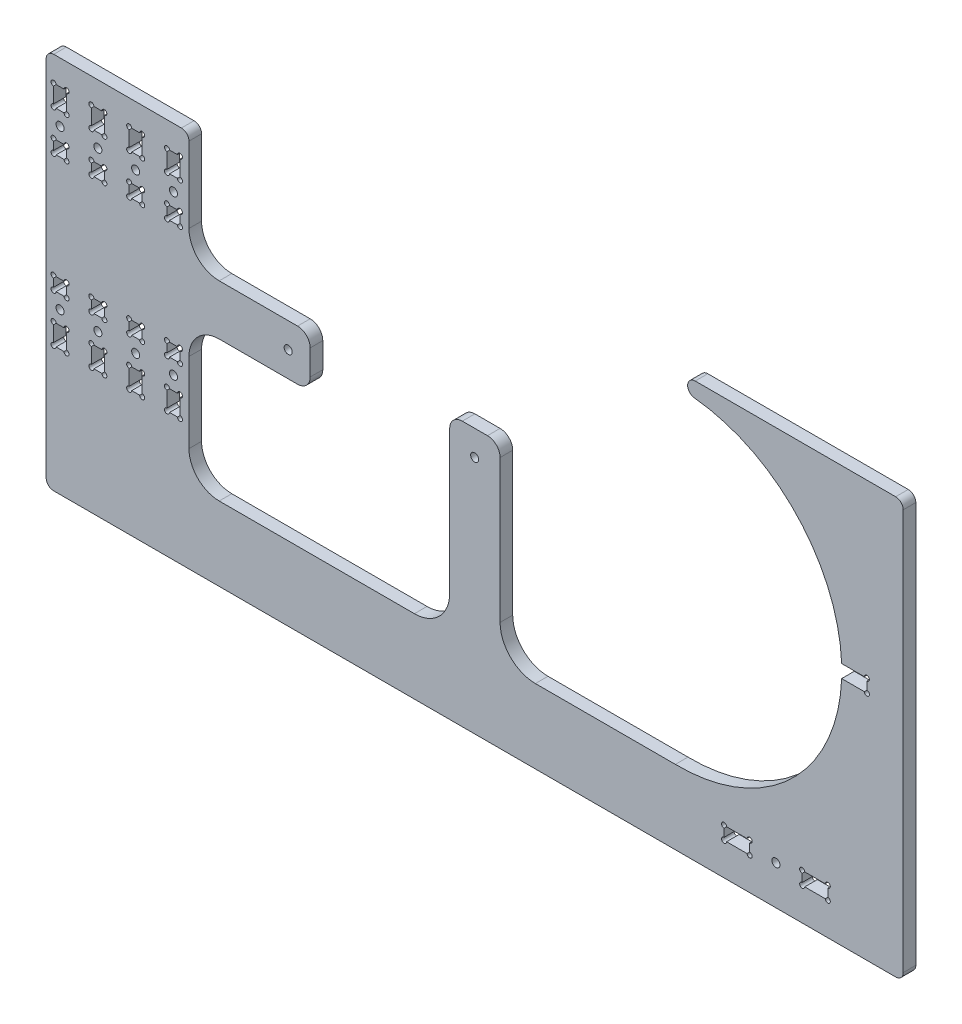
from build123d import *

# Parameters (mm, degrees)
ESBO_O1_R             = 1.500000231
ESBO_O1_R_2           = 1.500000287
ESBO_O1_R_3           = 1.500000265
ESBO_O1_W             = 5.150000881
ESBO_O1_H             = 5.150000897
ESBO_O1_H_2           = 5.150000136
ESBO_O1_H_3           = 8.1500015
ESBO_O1_H_4           = 8.150001441
ESBO_O1_W_2           = 10.150001764
ESBO_O1_H_5           = 5.150000882
ESBO_O1_W_3           = 10.150001763
FLANGE_BASE1_DEPTH    = 5
QUEBRA_CANTO1_START   = -5
QUEBRA_CANTO1_DEPTH   = 5
ESBO_O3_R             = 1
CORTE_EXTRUS_O1_DEPTH = 5
CORTE_EXTRUS_O2_REACH = 379.955
ESBO_O4_R             = 1.6


# Read off the part's stored shape, not the designer's step: Quebra-Canto1
# Sheet-metal steps are written as plain solids
with BuildPart() as part:
    # Esboço1 → Flange-base1 (new body)
    with BuildSketch(Plane.XY):
        with BuildLine():
            Line((-340, 3.000000529), (-340, 147.005540143))
            ThreePointArc((-340, 147.005540143), (-339.121320189, 149.126860861), (-336.999999471, 150.005540672))
            Line((-336.999999471, 150.005540672), (-286.361235163, 150.005540672))
            ThreePointArc((-286.361235163, 150.005540672), (-284.239914446, 149.126860861), (-283.361234634, 147.005540143))
            Line((-283.361234634, 147.005540143), (-283.361234634, 105.00038556))
            Line((-283.361234634, 105.00038556), (-240.264936372, 105.00038556))
            ThreePointArc((-240.264936372, 105.00038556), (-236.729401842, 103.535919208), (-235.26493549, 100.000384678))
            Line((-235.26493549, 100.000384678), (-235.26493549, 90.00001714))
            ThreePointArc((-235.26493549, 90.00001714), (-236.729401842, 86.46448261), (-240.264936372, 85.000016258))
            Line((-240.264936372, 85.000016258), (-283.361234635, 85.000016258))
            Line((-283.361234635, 85.000016258), (-283.361234635, 41.352845177))
            ThreePointArc((-283.361234635, 41.352845177), (-279.846515389, 32.867562306), (-271.361232518, 29.35284306))
            Line((-271.361232518, 29.35284306), (-193.918634842, 29.35284306))
            ThreePointArc((-193.918634842, 29.35284306), (-184.019138159, 33.453348847), (-179.918632372, 43.35284553))
            Line((-179.918632372, 43.35284553), (-179.918632372, 100.015701137))
            ThreePointArc((-179.918632372, 100.015701137), (-178.45416602, 103.551235666), (-174.91863149, 105.015702019))
            Line((-174.91863149, 105.015702019), (-164.925235472, 105.015702019))
            ThreePointArc((-164.925235472, 105.015702019), (-161.389700943, 103.551235666), (-159.92523459, 100.015701137))
            Line((-159.92523459, 100.015701137), (-159.92523459, 43.35284553))
            ThreePointArc((-159.92523459, 43.35284553), (-155.824728804, 33.453348847), (-145.925232121, 29.35284306))
            Line((-145.925232121, 29.35284306), (-90.389869404, 29.35284306))
            ThreePointArc((-90.389869404, 29.35284306), (-44.67362864, 47.143845796), (-24.411355946, 91.819731385))
            Line((-24.411355946, 91.819731385), (-14.410292398, 91.819731385))
            Line((-14.410292398, 91.819731385), (-14.410292398, 96.969732249))
            Line((-14.410292398, 96.969732249), (-24.415320599, 96.969732249))
            ThreePointArc((-24.415320599, 96.969732249), (-42.034855913, 138.899349917), (-82.825688056, 159.015236068))
            ThreePointArc((-82.825688056, 159.015236068), (-85.520194125, 162.151065128), (-82.523998015, 165.000029101))
            Line((-82.523998015, 165.000029101), (-3.000000529, 165.000029101))
            ThreePointArc((-3.000000529, 165.000029101), (-0.878679811, 164.12134929), (0, 162.000028572))
            Line((0, 162.000028572), (0, 3.000000529))
            ThreePointArc((0, 3.000000529), (-0.878679811, 0.878679811), (-3.000000529, 0))
            Line((-3.000000529, 0), (-336.999999471, 0))
            ThreePointArc((-336.999999471, 0), (-339.121320189, 0.878679811), (-340, 3.000000529))
        make_face()
        with Locations((-289.500044588, 63.50000978)):
            Circle(ESBO_O1_R, mode=Mode.SUBTRACT)
        with Locations((-289.500055373, 126.500024196)):
            Circle(ESBO_O1_R_2, mode=Mode.SUBTRACT)
        with Locations((-244.00004667, 95.000018171)):
            Circle(ESBO_O1_R_3, mode=Mode.SUBTRACT)
        with Locations((-170.000032516, 95.000018171)):
            Circle(ESBO_O1_R_3, mode=Mode.SUBTRACT)
        with Locations((-50.500009659, 15.500002965)):
            Circle(ESBO_O1_R_2, mode=Mode.SUBTRACT)
        with Locations((-304.500044588, 63.50000978)):
            Circle(ESBO_O1_R, mode=Mode.SUBTRACT)
        with Locations((-304.500055373, 126.500024196)):
            Circle(ESBO_O1_R_2, mode=Mode.SUBTRACT)
        with Locations((-319.500044588, 63.50000978)):
            Circle(ESBO_O1_R, mode=Mode.SUBTRACT)
        with Locations((-319.500055373, 126.500024196)):
            Circle(ESBO_O1_R_2, mode=Mode.SUBTRACT)
        with Locations((-334.500044588, 63.50000978)):
            Circle(ESBO_O1_R, mode=Mode.SUBTRACT)
        with Locations((-334.500055373, 126.500024196)):
            Circle(ESBO_O1_R_2, mode=Mode.SUBTRACT)
        with Locations((-289.499991094, 118.500022696)):
            Rectangle(ESBO_O1_W, ESBO_O1_H, mode=Mode.SUBTRACT)
        with Locations((-289.499991094, 71.500014026)):
            Rectangle(ESBO_O1_W, ESBO_O1_H_2, mode=Mode.SUBTRACT)
        with Locations((-289.499991094, 54.000010403)):
            Rectangle(ESBO_O1_W, ESBO_O1_H_3, mode=Mode.SUBTRACT)
        with Locations((-289.499991094, 136.000025968)):
            Rectangle(ESBO_O1_W, ESBO_O1_H_4, mode=Mode.SUBTRACT)
        with Locations((-35.004152945, 15.500002734)):
            Rectangle(ESBO_O1_W_2, ESBO_O1_H_5, mode=Mode.SUBTRACT)
        with Locations((-66.000012252, 15.500002734)):
            Rectangle(ESBO_O1_W_3, ESBO_O1_H_5, mode=Mode.SUBTRACT)
        with Locations((-304.499991094, 118.500022696)):
            Rectangle(ESBO_O1_W, ESBO_O1_H, mode=Mode.SUBTRACT)
        with Locations((-304.499991094, 71.500014026)):
            Rectangle(ESBO_O1_W, ESBO_O1_H_2, mode=Mode.SUBTRACT)
        with Locations((-304.499991094, 54.000010403)):
            Rectangle(ESBO_O1_W, ESBO_O1_H_3, mode=Mode.SUBTRACT)
        with Locations((-304.499991094, 136.000025968)):
            Rectangle(ESBO_O1_W, ESBO_O1_H_4, mode=Mode.SUBTRACT)
        with Locations((-319.499991094, 118.500022696)):
            Rectangle(ESBO_O1_W, ESBO_O1_H, mode=Mode.SUBTRACT)
        with Locations((-319.499991094, 71.500014026)):
            Rectangle(ESBO_O1_W, ESBO_O1_H_2, mode=Mode.SUBTRACT)
        with Locations((-319.499991094, 54.000010403)):
            Rectangle(ESBO_O1_W, ESBO_O1_H_3, mode=Mode.SUBTRACT)
        with Locations((-319.499991094, 136.000025968)):
            Rectangle(ESBO_O1_W, ESBO_O1_H_4, mode=Mode.SUBTRACT)
        with Locations((-334.499991094, 118.500022696)):
            Rectangle(ESBO_O1_W, ESBO_O1_H, mode=Mode.SUBTRACT)
        with Locations((-334.499991094, 71.500014026)):
            Rectangle(ESBO_O1_W, ESBO_O1_H_2, mode=Mode.SUBTRACT)
        with Locations((-334.499991094, 54.000010403)):
            Rectangle(ESBO_O1_W, ESBO_O1_H_3, mode=Mode.SUBTRACT)
        with Locations((-334.499991094, 136.000025968)):
            Rectangle(ESBO_O1_W, ESBO_O1_H_4, mode=Mode.SUBTRACT)
    extrude(amount=-FLANGE_BASE1_DEPTH)

    # Quebra-Canto1 outline → Quebra-Canto1 (add)
    with BuildSketch(Plane.XY.offset(QUEBRA_CANTO1_START)):
        with BuildLine():
            Line((-283.361234634, 105.00038556), (-271.361234634, 105.00038556))
            ThreePointArc((-271.361234634, 105.00038556), (-279.846516009, 108.515104186), (-283.361234634, 117.00038556))
            Line((-283.361234634, 117.00038556), (-283.361234634, 105.00038556))
        make_face()
        with BuildLine():
            Line((-283.361234635, 85.000016258), (-283.361234635, 73.000016258))
            ThreePointArc((-283.361234635, 73.000016258), (-279.846516009, 81.485297632), (-271.361234635, 85.000016258))
            Line((-271.361234635, 85.000016258), (-283.361234635, 85.000016258))
        make_face()
    extrude(amount=QUEBRA_CANTO1_DEPTH)

    # Esboço3 → Corte-extrusão1 (cut)
    with BuildSketch(Plane.XY):
        with Locations((-286.924990653, 140.075026689)):
            Circle(ESBO_O3_R)
        with Locations((-292.074991534, 140.075026689)):
            Circle(ESBO_O3_R)
        with Locations((-292.074991534, 131.925025248)):
            Circle(ESBO_O3_R)
        with Locations((-286.924990653, 131.925025248)):
            Circle(ESBO_O3_R)
        with Locations((-286.924990653, 74.075014094)):
            Circle(ESBO_O3_R)
        with Locations((-292.074991534, 74.075014094)):
            Circle(ESBO_O3_R)
        with Locations((-292.074991534, 68.925013958)):
            Circle(ESBO_O3_R)
        with Locations((-286.924990653, 68.925013958)):
            Circle(ESBO_O3_R)
        with Locations((-286.924990653, 58.075011153)):
            Circle(ESBO_O3_R)
        with Locations((-292.074991534, 58.075011153)):
            Circle(ESBO_O3_R)
        with Locations((-292.074991534, 49.925009653)):
            Circle(ESBO_O3_R)
        with Locations((-286.924990653, 49.925009653)):
            Circle(ESBO_O3_R)
        with Locations((-29.929152063, 12.925002293)):
            Circle(ESBO_O3_R)
        with Locations((-29.929152063, 18.075003175)):
            Circle(ESBO_O3_R)
        with Locations((-40.079153827, 18.075003175)):
            Circle(ESBO_O3_R)
        with Locations((-40.079153827, 12.925002293)):
            Circle(ESBO_O3_R)
        with Locations((-60.92501137, 12.925002293)):
            Circle(ESBO_O3_R)
        with Locations((-60.92501137, 18.075003175)):
            Circle(ESBO_O3_R)
        with Locations((-71.075013133, 18.075003175)):
            Circle(ESBO_O3_R)
        with Locations((-71.075013133, 12.925002293)):
            Circle(ESBO_O3_R)
        with Locations((-292.074991534, 121.075023144)):
            Circle(ESBO_O3_R)
        with Locations((-292.074991534, 115.925022247)):
            Circle(ESBO_O3_R)
        with Locations((-286.924990653, 115.925022247)):
            Circle(ESBO_O3_R)
        with Locations((-286.924990653, 121.075023144)):
            Circle(ESBO_O3_R)
        with Locations((-301.924990653, 140.075026689)):
            Circle(ESBO_O3_R)
        with Locations((-307.074991534, 140.075026689)):
            Circle(ESBO_O3_R)
        with Locations((-307.074991534, 131.925025248)):
            Circle(ESBO_O3_R)
        with Locations((-301.924990653, 131.925025248)):
            Circle(ESBO_O3_R)
        with Locations((-301.924990653, 74.075014094)):
            Circle(ESBO_O3_R)
        with Locations((-307.074991534, 74.075014094)):
            Circle(ESBO_O3_R)
        with Locations((-307.074991534, 68.925013958)):
            Circle(ESBO_O3_R)
        with Locations((-301.924990653, 68.925013958)):
            Circle(ESBO_O3_R)
        with Locations((-301.924990653, 58.075011153)):
            Circle(ESBO_O3_R)
        with Locations((-307.074991534, 58.075011153)):
            Circle(ESBO_O3_R)
        with Locations((-307.074991534, 49.925009653)):
            Circle(ESBO_O3_R)
        with Locations((-301.924990653, 49.925009653)):
            Circle(ESBO_O3_R)
        with Locations((-307.074991534, 121.075023144)):
            Circle(ESBO_O3_R)
        with Locations((-307.074991534, 115.925022247)):
            Circle(ESBO_O3_R)
        with Locations((-301.924990653, 115.925022247)):
            Circle(ESBO_O3_R)
        with Locations((-301.924990653, 121.075023144)):
            Circle(ESBO_O3_R)
        with Locations((-316.924990653, 140.075026689)):
            Circle(ESBO_O3_R)
        with Locations((-322.074991534, 140.075026689)):
            Circle(ESBO_O3_R)
        with Locations((-322.074991534, 131.925025248)):
            Circle(ESBO_O3_R)
        with Locations((-316.924990653, 131.925025248)):
            Circle(ESBO_O3_R)
        with Locations((-316.924990653, 74.075014094)):
            Circle(ESBO_O3_R)
        with Locations((-322.074991534, 74.075014094)):
            Circle(ESBO_O3_R)
        with Locations((-322.074991534, 68.925013958)):
            Circle(ESBO_O3_R)
        with Locations((-316.924990653, 68.925013958)):
            Circle(ESBO_O3_R)
        with Locations((-316.924990653, 58.075011153)):
            Circle(ESBO_O3_R)
        with Locations((-322.074991534, 58.075011153)):
            Circle(ESBO_O3_R)
        with Locations((-322.074991534, 49.925009653)):
            Circle(ESBO_O3_R)
        with Locations((-316.924990653, 49.925009653)):
            Circle(ESBO_O3_R)
        with Locations((-322.074991534, 121.075023144)):
            Circle(ESBO_O3_R)
        with Locations((-322.074991534, 115.925022247)):
            Circle(ESBO_O3_R)
        with Locations((-316.924990653, 115.925022247)):
            Circle(ESBO_O3_R)
        with Locations((-316.924990653, 121.075023144)):
            Circle(ESBO_O3_R)
        with Locations((-331.924990653, 140.075026689)):
            Circle(ESBO_O3_R)
        with Locations((-337.074991534, 140.075026689)):
            Circle(ESBO_O3_R)
        with Locations((-337.074991534, 131.925025248)):
            Circle(ESBO_O3_R)
        with Locations((-331.924990653, 131.925025248)):
            Circle(ESBO_O3_R)
        with Locations((-331.924990653, 74.075014094)):
            Circle(ESBO_O3_R)
        with Locations((-337.074991534, 74.075014094)):
            Circle(ESBO_O3_R)
        with Locations((-337.074991534, 68.925013958)):
            Circle(ESBO_O3_R)
        with Locations((-331.924990653, 68.925013958)):
            Circle(ESBO_O3_R)
        with Locations((-331.924990653, 58.075011153)):
            Circle(ESBO_O3_R)
        with Locations((-337.074991534, 58.075011153)):
            Circle(ESBO_O3_R)
        with Locations((-337.074991534, 49.925009653)):
            Circle(ESBO_O3_R)
        with Locations((-331.924990653, 49.925009653)):
            Circle(ESBO_O3_R)
        with Locations((-337.074991534, 121.075023144)):
            Circle(ESBO_O3_R)
        with Locations((-337.074991534, 115.925022247)):
            Circle(ESBO_O3_R)
        with Locations((-331.924990653, 115.925022247)):
            Circle(ESBO_O3_R)
        with Locations((-331.924990653, 121.075023144)):
            Circle(ESBO_O3_R)
        with Locations((-14.410292398, 96.969732249)):
            Circle(ESBO_O3_R)
        with Locations((-14.410292398, 91.819731385)):
            Circle(ESBO_O3_R)
    extrude(amount=-CORTE_EXTRUS_O1_DEPTH, mode=Mode.SUBTRACT)

    # Esboço4 → Corte-extrusão2 (cut, up to next)
    with BuildSketch(Plane.XY, mode=Mode.PRIVATE) as corte_extrus_o2_sk1:
        with Locations((-289.500055373, 126.500024196)):
            Circle(ESBO_O4_R)
    corte_extrus_o2_tool1 = extrude(corte_extrus_o2_sk1.sketch, amount=-CORTE_EXTRUS_O2_REACH, mode=Mode.PRIVATE) & part.part
    # Esboço4 → Corte-extrusão2 (cut, up to next)
    with BuildSketch(Plane.XY, mode=Mode.PRIVATE) as corte_extrus_o2_sk2:
        with Locations((-289.500044588, 63.50000978)):
            Circle(ESBO_O4_R)
    corte_extrus_o2_tool2 = extrude(corte_extrus_o2_sk2.sketch, amount=-CORTE_EXTRUS_O2_REACH, mode=Mode.PRIVATE) & part.part
    # Esboço4 → Corte-extrusão2 (cut, up to next)
    with BuildSketch(Plane.XY, mode=Mode.PRIVATE) as corte_extrus_o2_sk3:
        with Locations((-244.00004667, 95.000018171)):
            Circle(ESBO_O4_R)
    corte_extrus_o2_tool3 = extrude(corte_extrus_o2_sk3.sketch, amount=-CORTE_EXTRUS_O2_REACH, mode=Mode.PRIVATE) & part.part
    # Esboço4 → Corte-extrusão2 (cut, up to next)
    with BuildSketch(Plane.XY, mode=Mode.PRIVATE) as corte_extrus_o2_sk4:
        with Locations((-170.000032516, 95.000018171)):
            Circle(ESBO_O4_R)
    corte_extrus_o2_tool4 = extrude(corte_extrus_o2_sk4.sketch, amount=-CORTE_EXTRUS_O2_REACH, mode=Mode.PRIVATE) & part.part
    # Esboço4 → Corte-extrusão2 (cut, up to next)
    with BuildSketch(Plane.XY, mode=Mode.PRIVATE) as corte_extrus_o2_sk5:
        with Locations((-50.500009659, 15.500002965)):
            Circle(ESBO_O4_R)
    corte_extrus_o2_tool5 = extrude(corte_extrus_o2_sk5.sketch, amount=-CORTE_EXTRUS_O2_REACH, mode=Mode.PRIVATE) & part.part
    # Esboço4 → Corte-extrusão2 (cut, up to next)
    with BuildSketch(Plane.XY, mode=Mode.PRIVATE) as corte_extrus_o2_sk6:
        with Locations((-304.500055373, 126.500024196)):
            Circle(ESBO_O4_R)
    corte_extrus_o2_tool6 = extrude(corte_extrus_o2_sk6.sketch, amount=-CORTE_EXTRUS_O2_REACH, mode=Mode.PRIVATE) & part.part
    # Esboço4 → Corte-extrusão2 (cut, up to next)
    with BuildSketch(Plane.XY, mode=Mode.PRIVATE) as corte_extrus_o2_sk7:
        with Locations((-304.500044588, 63.50000978)):
            Circle(ESBO_O4_R)
    corte_extrus_o2_tool7 = extrude(corte_extrus_o2_sk7.sketch, amount=-CORTE_EXTRUS_O2_REACH, mode=Mode.PRIVATE) & part.part
    # Esboço4 → Corte-extrusão2 (cut, up to next)
    with BuildSketch(Plane.XY, mode=Mode.PRIVATE) as corte_extrus_o2_sk8:
        with Locations((-319.500055373, 126.500024196)):
            Circle(ESBO_O4_R)
    corte_extrus_o2_tool8 = extrude(corte_extrus_o2_sk8.sketch, amount=-CORTE_EXTRUS_O2_REACH, mode=Mode.PRIVATE) & part.part
    # Esboço4 → Corte-extrusão2 (cut, up to next)
    with BuildSketch(Plane.XY, mode=Mode.PRIVATE) as corte_extrus_o2_sk9:
        with Locations((-319.500044588, 63.50000978)):
            Circle(ESBO_O4_R)
    corte_extrus_o2_tool9 = extrude(corte_extrus_o2_sk9.sketch, amount=-CORTE_EXTRUS_O2_REACH, mode=Mode.PRIVATE) & part.part
    # Esboço4 → Corte-extrusão2 (cut, up to next)
    with BuildSketch(Plane.XY, mode=Mode.PRIVATE) as corte_extrus_o2_sk10:
        with Locations((-334.500055373, 126.500024196)):
            Circle(ESBO_O4_R)
    corte_extrus_o2_tool10 = extrude(corte_extrus_o2_sk10.sketch, amount=-CORTE_EXTRUS_O2_REACH, mode=Mode.PRIVATE) & part.part
    # Esboço4 → Corte-extrusão2 (cut, up to next)
    with BuildSketch(Plane.XY, mode=Mode.PRIVATE) as corte_extrus_o2_sk11:
        with Locations((-334.500044588, 63.50000978)):
            Circle(ESBO_O4_R)
    corte_extrus_o2_tool11 = extrude(corte_extrus_o2_sk11.sketch, amount=-CORTE_EXTRUS_O2_REACH, mode=Mode.PRIVATE) & part.part
    add(corte_extrus_o2_tool1.solids().sort_by_distance((-289.500055, 126.500024, 0))[0], mode=Mode.SUBTRACT)
    add(corte_extrus_o2_tool2.solids().sort_by_distance((-289.500045, 63.50001, 0))[0], mode=Mode.SUBTRACT)
    add(corte_extrus_o2_tool3.solids().sort_by_distance((-244.000047, 95.000018, 0))[0], mode=Mode.SUBTRACT)
    add(corte_extrus_o2_tool4.solids().sort_by_distance((-170.000033, 95.000018, 0))[0], mode=Mode.SUBTRACT)
    add(corte_extrus_o2_tool5.solids().sort_by_distance((-50.50001, 15.500003, 0))[0], mode=Mode.SUBTRACT)
    add(corte_extrus_o2_tool6.solids().sort_by_distance((-304.500055, 126.500024, 0))[0], mode=Mode.SUBTRACT)
    add(corte_extrus_o2_tool7.solids().sort_by_distance((-304.500045, 63.50001, 0))[0], mode=Mode.SUBTRACT)
    add(corte_extrus_o2_tool8.solids().sort_by_distance((-319.500055, 126.500024, 0))[0], mode=Mode.SUBTRACT)
    add(corte_extrus_o2_tool9.solids().sort_by_distance((-319.500045, 63.50001, 0))[0], mode=Mode.SUBTRACT)
    add(corte_extrus_o2_tool10.solids().sort_by_distance((-334.500055, 126.500024, 0))[0], mode=Mode.SUBTRACT)
    add(corte_extrus_o2_tool11.solids().sort_by_distance((-334.500045, 63.50001, 0))[0], mode=Mode.SUBTRACT)


solid = part.part
